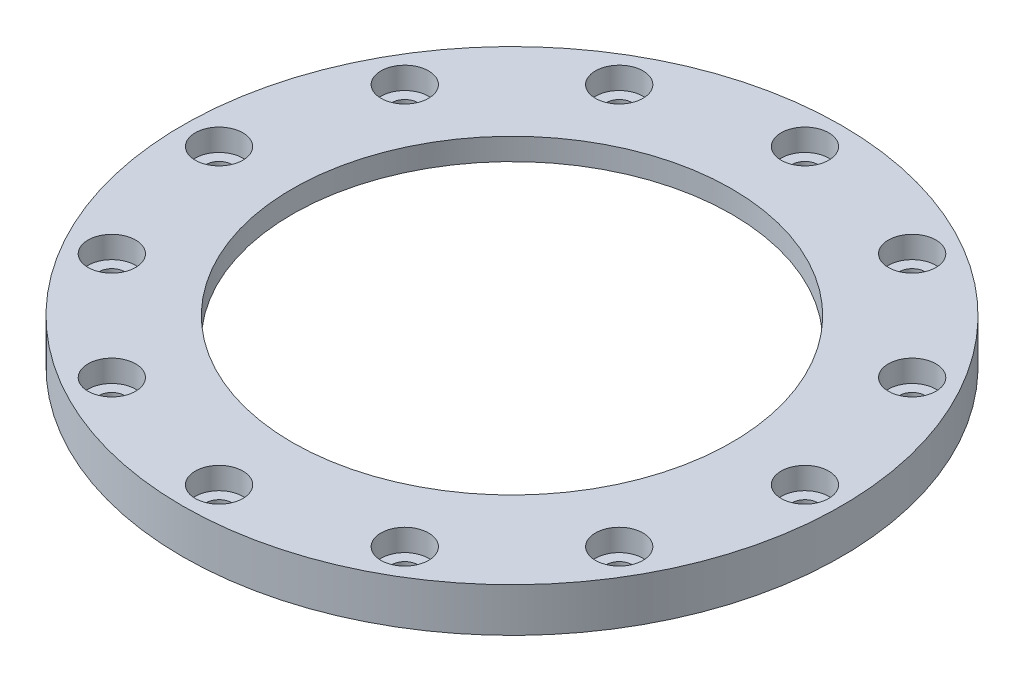
from build123d import *

# Parameters (mm, degrees)
SKETCH1_R           = 45
SKETCH1_R_2         = 30
SKETCH1_R_3         = 1.75
BOSS_EXTRUDE1_DEPTH = 6
SKETCH2_R           = 35.5
CUT_EXTRUDE1_DEPTH  = 3
SKETCH3_R           = 3.25
CUT_EXTRUDE2_DEPTH  = 3


with BuildPart() as part:
    # Sketch1 → Boss-Extrude1 (new body)
    with BuildSketch(Plane(origin=(0, 0, 0), x_dir=(1, 0, 0), z_dir=(0, 1, 0))):
        Circle(SKETCH1_R)
        Circle(SKETCH1_R_2, mode=Mode.SUBTRACT)
        with Locations((0, 40)):
            Circle(SKETCH1_R_3, mode=Mode.SUBTRACT)
        with Locations((20, 34.641016151)):
            Circle(SKETCH1_R_3, mode=Mode.SUBTRACT)
        with Locations((34.641016151, 20)):
            Circle(SKETCH1_R_3, mode=Mode.SUBTRACT)
        with Locations((40, 0)):
            Circle(SKETCH1_R_3, mode=Mode.SUBTRACT)
        with Locations((34.641016151, -20)):
            Circle(SKETCH1_R_3, mode=Mode.SUBTRACT)
        with Locations((20, -34.641016151)):
            Circle(SKETCH1_R_3, mode=Mode.SUBTRACT)
        with Locations((0, -40)):
            Circle(SKETCH1_R_3, mode=Mode.SUBTRACT)
        with Locations((-20, -34.641016151)):
            Circle(SKETCH1_R_3, mode=Mode.SUBTRACT)
        with Locations((-34.641016151, -20)):
            Circle(SKETCH1_R_3, mode=Mode.SUBTRACT)
        with Locations((-40, 0)):
            Circle(SKETCH1_R_3, mode=Mode.SUBTRACT)
        with Locations((-34.641016151, 20)):
            Circle(SKETCH1_R_3, mode=Mode.SUBTRACT)
        with Locations((-20, 34.641016151)):
            Circle(SKETCH1_R_3, mode=Mode.SUBTRACT)
    extrude(amount=BOSS_EXTRUDE1_DEPTH)

    # Sketch2 → Cut-Extrude1 (cut)
    with BuildSketch(Plane.XZ):
        Circle(SKETCH2_R)
    extrude(amount=-CUT_EXTRUDE1_DEPTH, mode=Mode.SUBTRACT)

    # Sketch3 → Cut-Extrude2 (cut)
    with BuildSketch(Plane(origin=(0, 6, 0), x_dir=(1, 0, 0), z_dir=(0, 1, 0))):
        with Locations((40, 0)):
            Circle(SKETCH3_R)
        with Locations((34.641016151, -20)):
            Circle(SKETCH3_R)
        with Locations((20, -34.641016151)):
            Circle(SKETCH3_R)
        with Locations((0, -40)):
            Circle(SKETCH3_R)
        with Locations((-20, -34.641016151)):
            Circle(SKETCH3_R)
        with Locations((-34.641016151, -20)):
            Circle(SKETCH3_R)
        with Locations((-40, 0)):
            Circle(SKETCH3_R)
        with Locations((-34.641016151, 20)):
            Circle(SKETCH3_R)
        with Locations((-20, 34.641016151)):
            Circle(SKETCH3_R)
        with Locations((0, 40)):
            Circle(SKETCH3_R)
        with Locations((20, 34.641016151)):
            Circle(SKETCH3_R)
        with Locations((34.641016151, 20)):
            Circle(SKETCH3_R)
    extrude(amount=-CUT_EXTRUDE2_DEPTH, mode=Mode.SUBTRACT)


solid = part.part
